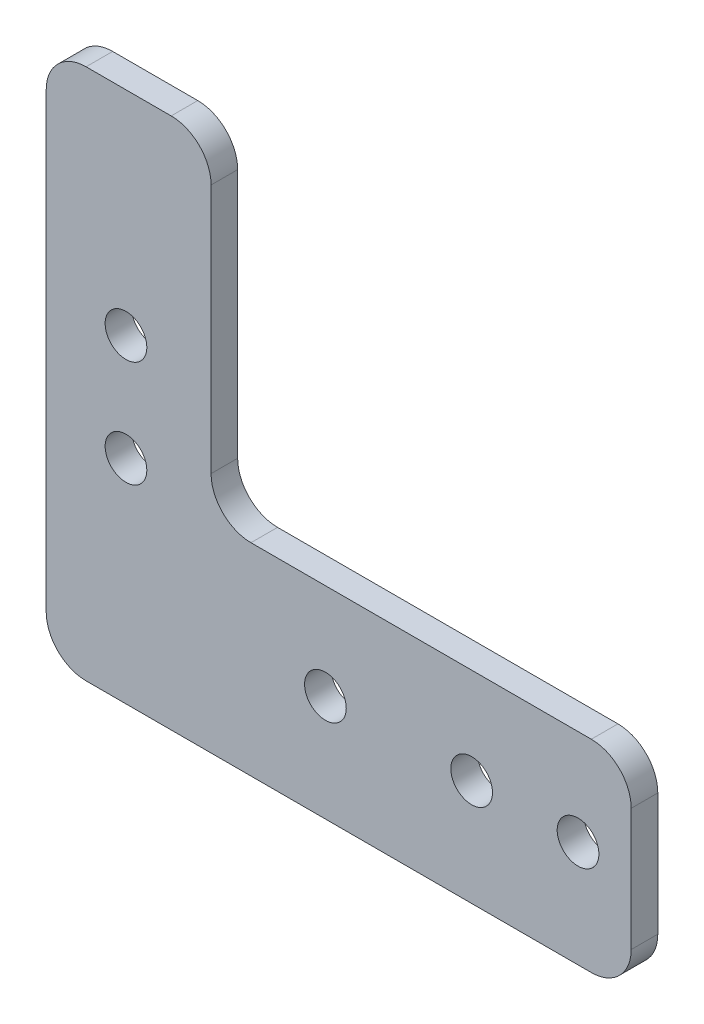
from build123d import *

# Parameters (mm, degrees)
SKETCH1_R          = 2.4892
BASE_FLANGE1_DEPTH = 3.175
FILLET2_R          = 4.7625


# Sheet-metal steps are written as plain solids
with BuildPart() as part:
    # Sketch1 → Base-Flange1 (new body)
    with BuildSketch(Plane.XY):
        Polygon((-15.24, 31.75), (-34.925, 31.75), (-34.925, -31.75), (34.925, -31.75), (34.925, -7.62), (-15.24, -7.62), align=None)
        with Locations((-25.4, -6.35)):
            Circle(SKETCH1_R, mode=Mode.SUBTRACT)
        with Locations((-25.4, 6.35)):
            Circle(SKETCH1_R, mode=Mode.SUBTRACT)
        with Locations((-1.5875, -19.05)):
            Circle(SKETCH1_R, mode=Mode.SUBTRACT)
        with Locations((15.875, -19.05)):
            Circle(SKETCH1_R, mode=Mode.SUBTRACT)
        with Locations((28.575, -19.05)):
            Circle(SKETCH1_R, mode=Mode.SUBTRACT)
    extrude(amount=-BASE_FLANGE1_DEPTH)

    # Fillet2
    fillet2_edges = [part.edges().sort_by_distance(p)[0] for p in [
        (-34.925, -31.75, -1.5875),
        (34.925, -31.75, -1.5875),
        (34.925, -7.62, -1.5875),
        (-15.24, -7.62, -1.5875),
        (-15.24, 31.75, -1.5875),
        (-34.925, 31.75, -1.5875),
    ]]
    fillet(fillet2_edges, radius=FILLET2_R)


solid = part.part
